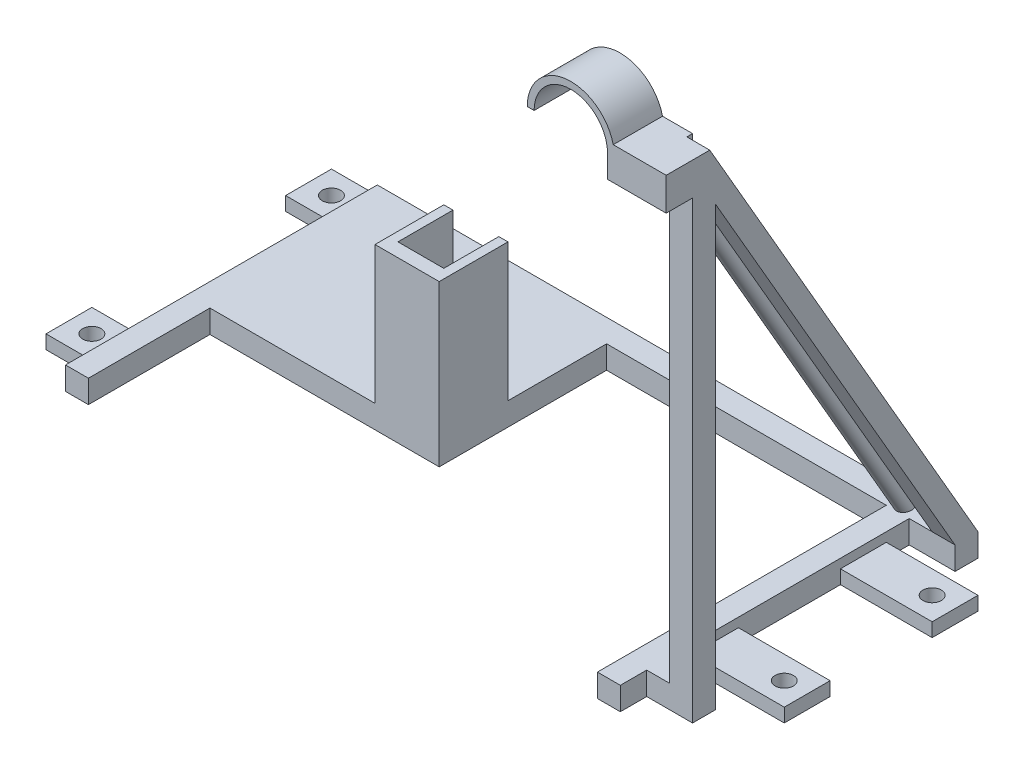
from build123d import *
from OCP.BRepAlgoAPI import BRepAlgoAPI_Cut
from OCP.TopTools import TopTools_ListOfShape

# Parameters (mm, degrees)
BOSS_EXTRUDE1_DEPTH              = 5
SKETCH2_R                        = 1.5
BOSS_EXTRUDE2_DEPTH              = 100
SKETCH3_W                        = 5
SKETCH3_H                        = 5
BOSS_EXTRUDE3_DEPTH              = 10
SKETCH5_W                        = 5
SKETCH5_H                        = 4.330127019
BOSS_EXTRUDE4_DEPTH              = 117
SKETCH6_W                        = 5
SKETCH6_H                        = 5
BOSS_EXTRUDE5_DEPTH              = 20
BOSS_EXTRUDE6_DEPTH              = 15
SKETCH9_W                        = 5
SKETCH9_H                        = 5
BOSS_EXTRUDE7_DEPTH              = 10
SKETCH10_W                       = 5
SKETCH10_H                       = 5
BOSS_EXTRUDE8_DEPTH              = 99.159909
SKETCH11_W                       = 10
SKETCH11_H                       = 3
BOSS_EXTRUDE9_DEPTH              = 10
CUT_EXTRUDE1_DEPTH               = 187.084790711
CUT_EXTRUDE1_DEPTH_BACK          = 187.084790711
SKETCH13_R                       = 2
SKETCH14_W                       = 10
SKETCH14_H                       = 3
BOSS_EXTRUDE10_DEPTH             = 20
CUT_EXTRUDE2_DEPTH               = 194.255140511
CUT_EXTRUDE2_DEPTH_BACK          = 194.255140511
SKETCH15_R                       = 2
BOSS_EXTRUDE11_DEPTH             = 7.8
CUT_EXTRUDE3_DEPTH               = 187.016127587
CUT_EXTRUDE3_DEPTH_BACK          = 187.016127587
SKETCH17_W                       = 22.17902444
SKETCH17_H                       = 20
BOSS_EXTRUDE12_DEPTH             = 5.75
BOSS_EXTRUDE12_DEPTH_BACK        = 5
SKETCH19_W                       = 1.5
SKETCH19_H                       = 10.75
BOSS_EXTRUDE13_DEPTH             = 2.742414
SKETCH21_W                       = 1.5
SKETCH21_H                       = 1
BOSS_EXTRUDE15_DEPTH             = 1
BOSS_EXTRUDE17_REACH             = 195.512
CUT_EXTRUDE4_START               = 2
SKETCH23_W                       = 7.8
SKETCH23_H                       = 12
CUT_EXTRUDE4_DEPTH               = 10
BOSS_EXTRUDE19_DEPTH             = 5
BOSS_EXTRUDE19_DEPTH_BACK        = 2.165064
SKETCH23_2_W                     = 7.8
SKETCH23_2_H                     = 12
CUT_EXTRUDE5_DEPTH               = 1.25
BOSS_EXTRUDE20_REACH             = 188.016
SKETCH25_W                       = 5
SKETCH25_H                       = 4.330127019
SKETCH26_W                       = 5
SKETCH26_H                       = 2.16506351
CUT_EXTRUDE6_DEPTH               = 5
SKETCH27_W                       = 5.75
SKETCH27_H                       = 7.16506351
BOSS_EXTRUDE21_DEPTH             = 5
SKETCH29_W                       = 3
SKETCH29_H                       = 30
BOSS_EXTRUDE22_DEPTH             = 55
SKETCH30_W                       = 5
SKETCH30_H                       = 3
BOSS_EXTRUDE23_DEPTH             = 5
SKETCH31_W                       = 5
SKETCH31_H                       = 5
BOSS_EXTRUDE24_DEPTH             = 33.5
SKETCH32_W                       = 2
SKETCH32_H                       = 19
BOSS_EXTRUDE25_DEPTH             = 12
SKETCH34_W                       = 41
SKETCH34_H                       = 3
CUT_EXTRUDE7_DEPTH               = 30
SKETCH35_W                       = 14
SKETCH35_H                       = 12
BOSS_EXTRUDE26_DEPTH             = 7
BOSS_EXTRUDE27_REACH             = 187.154
SKETCH36_W                       = 9
SKETCH36_H                       = 5
BOSS_EXTRUDE27_DIRECTION_2_REACH = 187.154
SKETCH37_W                       = 41.5
SKETCH37_H                       = 5
BOSS_EXTRUDE28_DEPTH             = 41


with BuildPart() as part:
    # Sketch1 → Boss-Extrude1 (new body)
    with BuildSketch(Plane(origin=(0, 0, 0), x_dir=(1, 0, 0), z_dir=(0, 1, 0))):
        Polygon((121, 0), (0, 0), (0, -68), (5, -68), (5, -5), (116, -5), (116, -68), (121, -68), align=None)
    extrude(amount=BOSS_EXTRUDE1_DEPTH)

    # Sketch2 → Boss-Extrude2 (add)
    with BuildSketch(Plane(origin=(0, 3.75, 2.165063509), x_dir=(1, 0, 0), z_dir=(0, 0.866025403784438, 0.500000000000001))):
        with Locations(Location((118.200131686, -0.299868314, 0), (0, 0, 90))):
            Circle(SKETCH2_R)
    extrude(amount=BOSS_EXTRUDE2_DEPTH)

    # Sketch3 → Boss-Extrude3 (add)
    with BuildSketch(Plane(origin=(121, 0, 0), x_dir=(0, 0, -1), z_dir=(1, 0, 0))):
        with Locations((-2.5, 2.5)):
            Rectangle(SKETCH3_W, SKETCH3_H)
    extrude(amount=BOSS_EXTRUDE3_DEPTH)

    # Sketch5 → Boss-Extrude4 (add)
    with BuildSketch(Plane(origin=(0, 3.75, 2.165063509), x_dir=(1, 0, 0), z_dir=(0, 0.866025403784438, 0.500000000000001))):
        with Locations((128.5, 0.33493649)):
            Rectangle(SKETCH5_W, SKETCH5_H)
    extrude(amount=BOSS_EXTRUDE4_DEPTH)

    # Sketch6 → Boss-Extrude5 (add)
    with BuildSketch(Plane(origin=(0, 1.25, -2.165063509), x_dir=(-1, 0, 0), z_dir=(0, 0.500000000000001, -0.8660254037844382))):
        with Locations((-128.5, 118.830127019)):
            Rectangle(SKETCH6_W, SKETCH6_H)
    extrude(amount=BOSS_EXTRUDE5_DEPTH)

    # Sketch7 → Boss-Extrude6 (add)
    with BuildSketch(Plane.ZY.offset(-126)):
        Polygon((45.509618943, 113.824972243), (41.179491924, 116.324972243), (38.679491924, 111.994845224), (43.009618943, 109.494845224), align=None)
    extrude(amount=BOSS_EXTRUDE6_DEPTH)

    # Sketch9 → Boss-Extrude7 (add)
    with BuildSketch(Plane(origin=(121, 0, 0), x_dir=(0, 0, -1), z_dir=(1, 0, 0))):
        with Locations((-59.75, 2.5)):
            Rectangle(SKETCH9_W, SKETCH9_H)
    extrude(amount=BOSS_EXTRUDE7_DEPTH)

    # Sketch10 → Boss-Extrude8 (add)
    with BuildSketch(Plane(origin=(0, 5, 0), x_dir=(1, 0, 0), z_dir=(0, 1, 0))):
        with Locations((128.5, -59.75)):
            Rectangle(SKETCH10_W, SKETCH10_H)
    extrude(amount=BOSS_EXTRUDE8_DEPTH)

    # Sketch11 → Boss-Extrude9 (add)
    with BuildSketch(Plane.ZY):
        with Locations((57.25, 1.5)):
            Rectangle(SKETCH11_W, SKETCH11_H)
        with Locations((5, 1.5)):
            Rectangle(SKETCH11_W, SKETCH11_H)
    extrude(amount=BOSS_EXTRUDE9_DEPTH)

    # Sketch13 → Cut-Extrude1 (cut, two sides: drawn at the far end of the back side and taken through both)
    with BuildSketch(Plane(origin=(0, 3, 0), x_dir=(1, 0, 0), z_dir=(0, 1, 0)).offset(-CUT_EXTRUDE1_DEPTH_BACK)):
        with Locations(Location((-5, -5, 0), (0, 0, 270))):
            Circle(SKETCH13_R)
        with Locations(Location((-5, -57.25, 0), (0, 0, 270))):
            Circle(SKETCH13_R)
    extrude(amount=CUT_EXTRUDE1_DEPTH + CUT_EXTRUDE1_DEPTH_BACK, mode=Mode.SUBTRACT)

    # Sketch14 → Boss-Extrude10 (add)
    with BuildSketch(Plane(origin=(121, 0, 0), x_dir=(0, 0, -1), z_dir=(1, 0, 0))):
        with Locations((-15, 1.5)):
            Rectangle(SKETCH14_W, SKETCH14_H)
        with Locations((-47.25, 1.5)):
            Rectangle(SKETCH14_W, SKETCH14_H)
    extrude(amount=BOSS_EXTRUDE10_DEPTH)

    # Sketch15 → Cut-Extrude2 (cut, two sides: drawn at the far end of the back side and taken through both)
    with BuildSketch(Plane(origin=(0, 3, 0), x_dir=(1, 0, 0), z_dir=(0, 1, 0)).offset(-CUT_EXTRUDE2_DEPTH_BACK)):
        with Locations(Location((136, -15, 0), (0, 0, 270))):
            Circle(SKETCH15_R)
        with Locations(Location((136, -47.25, 0), (0, 0, 270))):
            Circle(SKETCH15_R)
    extrude(amount=CUT_EXTRUDE2_DEPTH + CUT_EXTRUDE2_DEPTH_BACK, mode=Mode.SUBTRACT)

    # Sketch16 → Boss-Extrude11 (add)
    with BuildSketch(Plane.ZY.offset(-126)):
        Polygon((49.839745962, 111.324972243), (67, 101.417494955), (64.5, 97.087367936), (47.339745962, 106.994845224), align=None)
    extrude(amount=BOSS_EXTRUDE11_DEPTH)

    # Sketch17 → Cut-Extrude3 (cut, two sides: drawn at the far end of the back side and taken through both)
    with BuildSketch(Plane(origin=(0, 105.074972243, 60.665063509), x_dir=(1, 0, 0), z_dir=(0, 0.8660254037844382, 0.500000000000001)).offset(-CUT_EXTRUDE3_DEPTH_BACK)):
        with Locations((119.91048778, 12.5)):
            Rectangle(SKETCH17_W, SKETCH17_H)
    extrude(amount=CUT_EXTRUDE3_DEPTH + CUT_EXTRUDE3_DEPTH_BACK, mode=Mode.SUBTRACT)



with BuildPart() as body_2:
    # Sketch18 → Boss-Extrude12 (new, two sides: drawn at the far end of the back side and taken through both)
    with BuildSketch(Plane.XY.offset(62.25).offset(-BOSS_EXTRUDE12_DEPTH_BACK)):
        with BuildLine():
            Line((118.2, 104.159908733), (119.7, 104.159908733))
            ThreePointArc((119.7, 104.159908733), (110.2, 113.659908733), (100.7, 104.159908733))
            Line((100.7, 104.159908733), (102.2, 104.159908733))
            ThreePointArc((102.2, 104.159908733), (110.2, 112.159908733), (118.2, 104.159908733))
        make_face()
    extrude(amount=BOSS_EXTRUDE12_DEPTH + BOSS_EXTRUDE12_DEPTH_BACK)


with BuildPart() as part_1:
    add(part.part)

    add(body_2.part)  # Boss-Extrude13 merges body 2
    # Sketch19 → Boss-Extrude13 (add)
    with BuildSketch(Plane.XZ.offset(-104.159908733)):
        with Locations((118.95, 62.625)):
            Rectangle(SKETCH19_W, SKETCH19_H)
    extrude(amount=BOSS_EXTRUDE13_DEPTH)

    # Sketch21 → Boss-Extrude15 (add)
    with BuildSketch(Plane.XZ.offset(-101.417494955)):
        with Locations((118.95, 67.5)):
            Rectangle(SKETCH21_W, SKETCH21_H)
    extrude(amount=BOSS_EXTRUDE15_DEPTH)

    # Boss-Extrude17: up to this plane
    boss_extrude17_end = Plane(origin=(119.7, 101.417494955, 68), z_dir=(0, 0, -1))
    # Sketch20 → Boss-Extrude17 (add, up to the surface)
    with BuildSketch(Plane(origin=(0, -3.657477288, 6.334936491), x_dir=(1, 0, 0), z_dir=(0, -0.5000000000000039, 0.8660254037844365)), mode=Mode.PRIVATE) as boss_extrude17_sk1:
        Polygon((126, 116.330127019), (126, 121.330127019), (119.7, 121.330127019), (118.2, 121.330127019), (118.2, 116.330127019), align=None)
    boss_extrude17_tool1 = split(extrude(boss_extrude17_sk1.sketch, amount=BOSS_EXTRUDE17_REACH, mode=Mode.PRIVATE), bisect_by=boss_extrude17_end, keep=Keep.BOTH, mode=Mode.PRIVATE)
    add(boss_extrude17_tool1.solids().sort_by_distance((122.1, 99.252431, 65.75))[0])

    # Sketch23 → Cut-Extrude4 (cut)
    with BuildSketch(Plane(origin=(0, 104.159908733, 0), x_dir=(-1, 0, 0), z_dir=(0, -1, 0)).offset(CUT_EXTRUDE4_START)):
        with Locations((-122.1, -62)):
            Rectangle(SKETCH23_W, SKETCH23_H)
    extrude(amount=CUT_EXTRUDE4_DEPTH, mode=Mode.SUBTRACT)

    # Sketch23<2> → Boss-Extrude19 (add, two sides: drawn at the far end of the back side and taken through both)
    with BuildSketch(Plane(origin=(0, 104.159908733, 0), x_dir=(-1, 0, 0), z_dir=(0, -1, 0)).offset(-BOSS_EXTRUDE19_DEPTH_BACK)):
        with Locations((-122.1, -62)):
            Rectangle(SKETCH23_2_W, SKETCH23_2_H)
    extrude(amount=BOSS_EXTRUDE19_DEPTH + BOSS_EXTRUDE19_DEPTH_BACK)


with BuildPart() as cut_extrude5_tool:
    # Sketch24 → Cut-Extrude5 (new body)
    with BuildSketch(Plane(origin=(0, 0, 56), x_dir=(-1, 0, 0), z_dir=(0, 0, -1))):
        Polygon((-126, 106.324972243), (-126, 101.994845224), (-126, 99.159908733), (-118.2, 99.159908733), (-118.2, 106.324972243), align=None)
    extrude(amount=-CUT_EXTRUDE5_DEPTH)


with BuildPart() as part_2:
    add(part_1.part)

    # Cut-Extrude5: cut by cut_extrude5_tool, with a tolerance
    cut_extrude5_stock = TopTools_ListOfShape()
    cut_extrude5_stock.Append(part_2.part.wrapped)
    cut_extrude5_tools = TopTools_ListOfShape()
    cut_extrude5_tools.Append(cut_extrude5_tool.part.wrapped)
    cut_extrude5_cut = BRepAlgoAPI_Cut()
    cut_extrude5_cut.SetArguments(cut_extrude5_stock)
    cut_extrude5_cut.SetTools(cut_extrude5_tools)
    cut_extrude5_cut.SetFuzzyValue(0.00001)
    cut_extrude5_cut.Build()
    add(Compound.cast(cut_extrude5_cut.Shape()).solids(), mode=Mode.REPLACE)

    # Boss-Extrude20: up to this face of the body (flat: up to its plane)
    boss_extrude20_end = Plane(part_2.part.faces().sort_by_distance((122.724999943, 106.324972733, 62.625))[0])
    # Sketch25 → Boss-Extrude20 (add, up to the picked face)
    with BuildSketch(Plane(origin=(0, 105.074972243, 60.665063509), x_dir=(1, 0, 0), z_dir=(0, 0.8660254037844382, 0.500000000000001)), mode=Mode.PRIVATE) as boss_extrude20_sk1:
        with Locations((128.5, 0.33493649)):
            Rectangle(SKETCH25_W, SKETCH25_H)
    boss_extrude20_tool1 = split(extrude(boss_extrude20_sk1.sketch, amount=BOSS_EXTRUDE20_REACH, mode=Mode.PRIVATE), bisect_by=boss_extrude20_end, keep=Keep.BOTH, mode=Mode.PRIVATE)
    add(boss_extrude20_tool1.solids().sort_by(Axis((128.5, 105.24244, 60.375), (0, 0.8660254037844382, 0.500000000000001)))[0])


with BuildPart() as cut_extrude6_tool:
    # Sketch26 → Cut-Extrude6 (new body)
    with BuildSketch(Plane.XY.offset(62.25)):
        with Locations((128.5, 105.242440488)):
            Rectangle(SKETCH26_W, SKETCH26_H)
    extrude(amount=CUT_EXTRUDE6_DEPTH)


with BuildPart() as part_3:
    add(part_2.part)

    # Cut-Extrude6: cut by cut_extrude6_tool, with a tolerance
    cut_extrude6_stock = TopTools_ListOfShape()
    cut_extrude6_stock.Append(part_3.part.wrapped)
    cut_extrude6_tools = TopTools_ListOfShape()
    cut_extrude6_tools.Append(cut_extrude6_tool.part.wrapped)
    cut_extrude6_cut = BRepAlgoAPI_Cut()
    cut_extrude6_cut.SetArguments(cut_extrude6_stock)
    cut_extrude6_cut.SetTools(cut_extrude6_tools)
    cut_extrude6_cut.SetFuzzyValue(0.00001)
    cut_extrude6_cut.Build()
    add(Compound.cast(cut_extrude6_cut.Shape()).solids(), mode=Mode.REPLACE)

    # Sketch27 → Boss-Extrude21 (add)
    with BuildSketch(Plane(origin=(126, 0, 0), x_dir=(0, 0, -1), z_dir=(1, 0, 0))):
        with Locations((-65.125, 102.742440488)):
            Rectangle(SKETCH27_W, SKETCH27_H)
    extrude(amount=BOSS_EXTRUDE21_DEPTH)

    # Sketch29 → Boss-Extrude22 (add)
    with BuildSketch(Plane.ZY):
        with Locations((40, 20)):
            Rectangle(SKETCH29_W, SKETCH29_H)
    extrude(amount=-BOSS_EXTRUDE22_DEPTH)

    # Sketch30 → Boss-Extrude23 (add)
    with BuildSketch(Plane.XZ.offset(-5)):
        with Locations((52.5, 40)):
            Rectangle(SKETCH30_W, SKETCH30_H)
    extrude(amount=BOSS_EXTRUDE23_DEPTH)

    # Sketch31 → Boss-Extrude24 (add)
    with BuildSketch(Plane(origin=(0, 0, 38.5), x_dir=(-1, 0, 0), z_dir=(0, 0, -1))):
        with Locations((-52.5, 2.5)):
            Rectangle(SKETCH31_W, SKETCH31_H)
    extrude(amount=BOSS_EXTRUDE24_DEPTH)

    # Sketch32 → Boss-Extrude25 (add)
    with BuildSketch(Plane(origin=(0, 0, 38.5), x_dir=(-1, 0, 0), z_dir=(0, 0, -1))):
        Polygon((-41, 9), (-53, 9), (-53, 35), (-55, 35), (-55, 7), (-41, 7), align=None)
        with Locations((-42, 25.5)):
            Rectangle(SKETCH32_W, SKETCH32_H)
    extrude(amount=BOSS_EXTRUDE25_DEPTH)

    # Sketch34 → Cut-Extrude7 (cut)
    with BuildSketch(Plane(origin=(0, 35, 0), x_dir=(1, 0, 0), z_dir=(0, 1, 0))):
        with Locations((20.5, -40)):
            Rectangle(SKETCH34_W, SKETCH34_H)
    extrude(amount=-CUT_EXTRUDE7_DEPTH, mode=Mode.SUBTRACT)

    # Sketch35 → Boss-Extrude26 (add)
    with BuildSketch(Plane.XZ.offset(-7)):
        with Locations((48, 32.5)):
            Rectangle(SKETCH35_W, SKETCH35_H)
    extrude(amount=BOSS_EXTRUDE26_DEPTH)

    # Boss-Extrude27: up to this face of the body (flat: up to its plane)
    boss_extrude27_end = Plane(part_3.part.faces().sort_by_distance((48.252808989, 19.016853933, 41.5))[0])
    # Sketch36 → Boss-Extrude27 (add, up to the picked face)
    with BuildSketch(Plane.XY.offset(38.5), mode=Mode.PRIVATE) as boss_extrude27_sk1:
        with Locations((45.5, 2.5)):
            Rectangle(SKETCH36_W, SKETCH36_H)
    boss_extrude27_tool1 = split(extrude(boss_extrude27_sk1.sketch, amount=BOSS_EXTRUDE27_REACH, mode=Mode.PRIVATE), bisect_by=boss_extrude27_end, keep=Keep.BOTH, mode=Mode.PRIVATE)
    add(boss_extrude27_tool1.solids().sort_by(Axis((45.5, 2.5, 38.5), (0, 0, 1)))[0])

    # Boss-Extrude27 direction 2: up to this face of the body (flat: up to its plane)
    boss_extrude27_direction_2_end = Plane(part_3.part.faces().sort_by_distance((27.5, 2.5, 5))[0])
    # Sketch36 → Boss-Extrude27 direction 2 (add, up to the picked face)
    with BuildSketch(Plane.XY.offset(38.5), mode=Mode.PRIVATE) as boss_extrude27_direction_2_sk1:
        with Locations((45.5, 2.5)):
            Rectangle(SKETCH36_W, SKETCH36_H)
    boss_extrude27_direction_2_tool1 = split(extrude(boss_extrude27_direction_2_sk1.sketch, amount=-BOSS_EXTRUDE27_DIRECTION_2_REACH, mode=Mode.PRIVATE), bisect_by=boss_extrude27_direction_2_end, keep=Keep.BOTH, mode=Mode.PRIVATE)
    add(boss_extrude27_direction_2_tool1.solids().sort_by(Axis((45.5, 2.5, 38.5), (0, 0, -1)))[0])

    # Sketch37 → Boss-Extrude28 (add)
    with BuildSketch(Plane.ZY.offset(-41)):
        with Locations((20.75, 2.5)):
            Rectangle(SKETCH37_W, SKETCH37_H)
    extrude(amount=BOSS_EXTRUDE28_DEPTH)


solid = part_3.part
